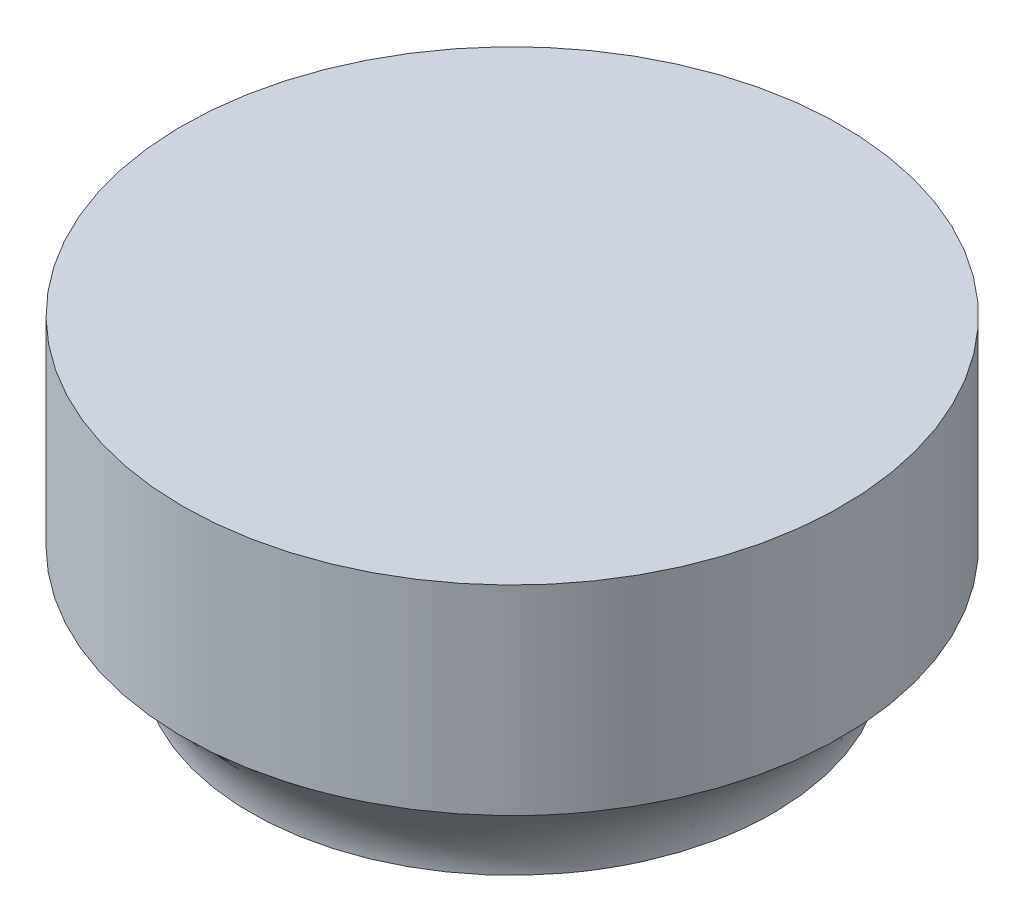
from build123d import *

# Parameters (mm, degrees)
SKETCH3_R           = 41.275
BOSS_EXTRUDE1_DEPTH = 25


with BuildPart() as part:
    # Loft1: read off the stored shape, not the designer's step
    # Loft1: loft between two sections, ruled curve by curve
    loft1_from = [
        Edge.make_bspline([(-31.134358767, 0, -10.159439166), (-51.453237099, 0, 52.109278368), (10.815480435, 0, 72.4281567), (31.134358767, 0, 10.159439166), (51.453237099, 0, -52.109278368), (-10.815480435, 0, -72.4281567), (-31.134358767, 0, -10.159439166)], [0, 0, 0, 0, 0.5, 0.5, 0.5, 1, 1, 1, 1], 3, [1, 0.333333333, 0.333333333, 1, 0.333333333, 0.333333333, 1]),
    ]
    loft1_to = [
        Edge.make_bspline([(-23.839313334, 12.499999892, -33.694402573), (-91.22811848, 12.499999892, 13.984224094), (-43.549491813, 12.499999892, 81.373029241), (23.839313334, 12.499999892, 33.694402573), (91.22811848, 12.499999892, -13.984224094), (43.549491813, 12.499999892, -81.373029241), (-23.839313334, 12.499999892, -33.694402573)], [0, 0, 0, 0, 0.5, 0.5, 0.5, 1, 1, 1, 1], 3, [1, 0.333333333, 0.333333333, 1, 0.333333333, 0.333333333, 1]),
    ]
    loft1 = Solid(Shell([*[Face.make_surface_from_curves(loft1_from[k], loft1_to[k]) for k in range(1)], Face(Wire(loft1_from)), Face(Wire(loft1_to))]))
    add(loft1)

    # Sketch3 → Boss-Extrude1 (add)
    with BuildSketch(Plane(origin=(0, 12.499999892, 0), x_dir=(1, 0, 0), z_dir=(0, 1, 0))):
        with Locations(Location((0, 0, 0), (0, 0, 125.28))):
            Circle(SKETCH3_R)
    extrude(amount=BOSS_EXTRUDE1_DEPTH)


solid = part.part
